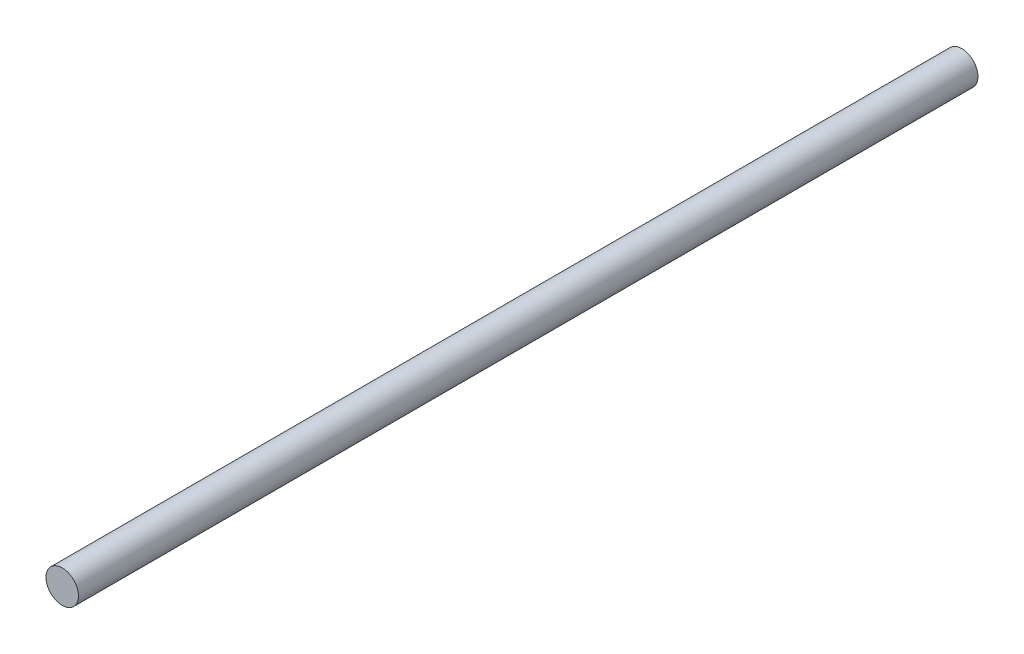
from build123d import *

# Parameters (mm, degrees)
SKETCH_1_R      = 6
EXTRUDE_1_DEPTH = 332


with BuildPart() as part:
    # Эскиз1 → Бобышка-Вытянуть1 (new body)
    with BuildSketch(Plane.XY):
        Circle(SKETCH_1_R)
    extrude(amount=EXTRUDE_1_DEPTH)


solid = part.part
